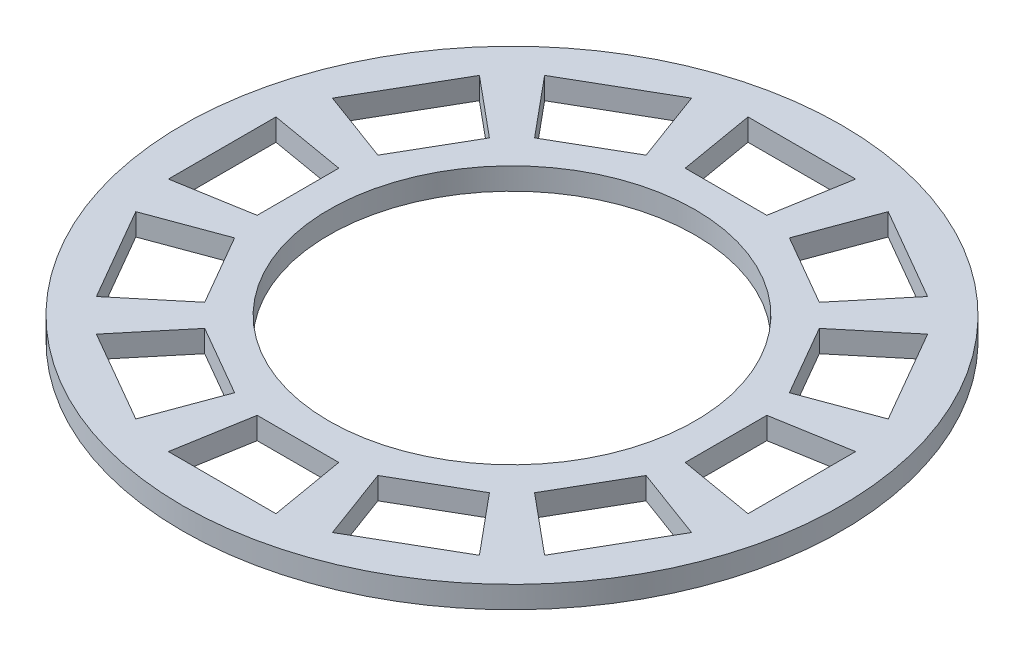
from build123d import *

# Parameters (mm, degrees)
SKETCH1_R           = 45
SKETCH1_R_2         = 25
BOSS_EXTRUDE1_DEPTH = 3


with BuildPart() as part:
    # Sketch1 → Boss-Extrude1 (new body)
    with BuildSketch(Plane(origin=(0, 0, 0), x_dir=(1, 0, 0), z_dir=(0, 1, 0))):
        Circle(SKETCH1_R)
        Circle(SKETCH1_R_2, mode=Mode.SUBTRACT)
        Polygon((-7.346, 39.573965988), (7.346, 39.573965988), (5.573, 29.223349757), (-5.573, 29.223349757), align=None, mode=Mode.SUBTRACT)
        Polygon((9.785315303, 28.094663273), (13.425160378, 37.945059874), (26.14880561, 30.599059874), (19.438034454, 22.521663273), align=None, mode=Mode.SUBTRACT)
        Polygon((22.521663273, 19.438034454), (30.599059874, 26.14880561), (37.945059874, 13.425160378), (28.094663273, 9.785315303), align=None, mode=Mode.SUBTRACT)
        Polygon((29.223349757, 5.573), (39.573965988, 7.346), (39.573965988, -7.346), (29.223349757, -5.573), align=None, mode=Mode.SUBTRACT)
        Polygon((28.094663273, -9.785315303), (37.945059874, -13.425160378), (30.599059874, -26.14880561), (22.521663273, -19.438034454), align=None, mode=Mode.SUBTRACT)
        Polygon((19.438034454, -22.521663273), (26.14880561, -30.599059874), (13.425160378, -37.945059874), (9.785315303, -28.094663273), align=None, mode=Mode.SUBTRACT)
        Polygon((5.573, -29.223349757), (7.346, -39.573965988), (-7.346, -39.573965988), (-5.573, -29.223349757), align=None, mode=Mode.SUBTRACT)
        Polygon((-9.785315303, -28.094663273), (-13.425160378, -37.945059874), (-26.14880561, -30.599059874), (-19.438034454, -22.521663273), align=None, mode=Mode.SUBTRACT)
        Polygon((-22.521663273, -19.438034454), (-30.599059874, -26.14880561), (-37.945059874, -13.425160378), (-28.094663273, -9.785315303), align=None, mode=Mode.SUBTRACT)
        Polygon((-29.223349757, -5.573), (-39.573965988, -7.346), (-39.573965988, 7.346), (-29.223349757, 5.573), align=None, mode=Mode.SUBTRACT)
        Polygon((-28.094663273, 9.785315303), (-37.945059874, 13.425160378), (-30.599059874, 26.14880561), (-22.521663273, 19.438034454), align=None, mode=Mode.SUBTRACT)
        Polygon((-19.438034454, 22.521663273), (-26.14880561, 30.599059874), (-13.425160378, 37.945059874), (-9.785315303, 28.094663273), align=None, mode=Mode.SUBTRACT)
    extrude(amount=BOSS_EXTRUDE1_DEPTH)


solid = part.part
